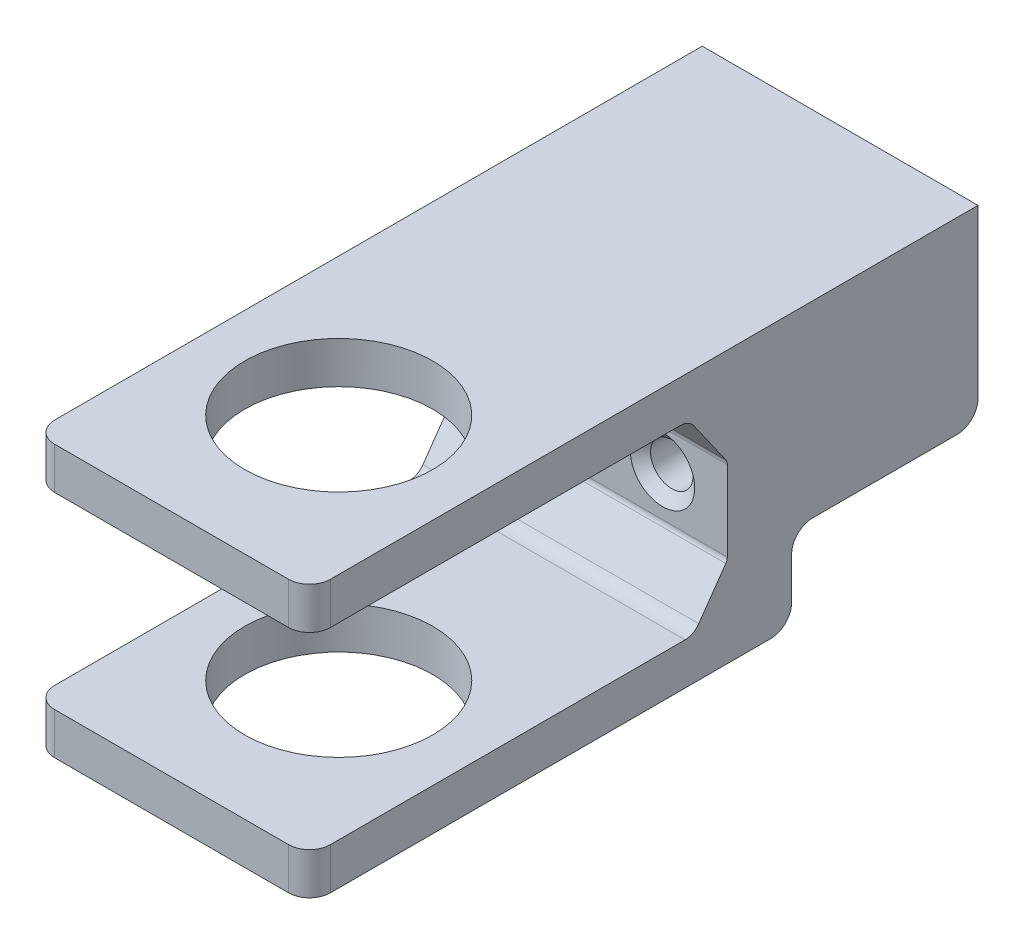
from build123d import *

# Parameters (mm, degrees)
SKETCH1_W                                          = 41.91
SKETCH1_H                                          = 101.6
BOSS_EXTRUDE1_DEPTH                                = 41.275
CUT_EXTRUDE6_DEPTH                                 = 78.72202857
SKETCH3_R                                          = 14.3002
CUT_EXTRUDE2_DEPTH                                 = 69.726833551
SKETCH17_W                                         = 28.321
SKETCH17_H                                         = 12.7
CUT_EXTRUDE7_DEPTH                                 = 78.72202857
SKETCH4_R                                          = 3.2258
CUT_EXTRUDE3_DEPTH                                 = 112.648097386
FILLET2_R                                          = 3.175
CSK_FOR_10_FLAT_HEAD_MACHINE_SCREW_100_D           = 5.6134
CSK_FOR_10_FLAT_HEAD_MACHINE_SCREW_100_DEPTH       = 38.1
CSK_FOR_10_FLAT_HEAD_MACHINE_SCREW_100_CSINK_D     = 9.779
CSK_FOR_10_FLAT_HEAD_MACHINE_SCREW_100_CSINK_ANGLE = 100
CSK_FOR_10_FLAT_HEAD_MACHINE_SCREW_100_TIP         = 1.686435499
FILLET3_R                                          = 2.54
FILLET4_R                                          = 1.27


with BuildPart() as part:
    # Sketch1 → Boss-Extrude1 (new body)
    with BuildSketch(Plane(origin=(0, 0, 0), x_dir=(1, 0, 0), z_dir=(0, 1, 0))):
        Rectangle(SKETCH1_W, SKETCH1_H)
    extrude(amount=BOSS_EXTRUDE1_DEPTH)

    # Sketch13 → Cut-Extrude6 (cut, through all)
    with BuildSketch(Plane.ZY.offset(20.955)):
        Polygon((-6.872463407, 34.925), (-12.7, 26.60241523), (-12.7, 13.632261674), (-7.600905481, 6.35), (50.8, 6.35), (50.8, 34.925), align=None)
    extrude(amount=-CUT_EXTRUDE6_DEPTH, mode=Mode.SUBTRACT)

    # Sketch3 → Cut-Extrude2 (cut, through all)
    with BuildSketch(Plane(origin=(0, 41.275, 0), x_dir=(1, 0, 0), z_dir=(0, 1, 0))):
        with Locations((0, -25.4)):
            Circle(SKETCH3_R)
    extrude(amount=-CUT_EXTRUDE2_DEPTH, mode=Mode.SUBTRACT)

    # Sketch17 → Cut-Extrude7 (cut, through all)
    with BuildSketch(Plane.ZY.offset(20.955)):
        with Locations((-36.6395, 6.35)):
            Rectangle(SKETCH17_W, SKETCH17_H)
    extrude(amount=-CUT_EXTRUDE7_DEPTH, mode=Mode.SUBTRACT)

    # Sketch4 → Cut-Extrude3 (cut, through all)
    with BuildSketch(Plane(origin=(0, 0, -50.8), x_dir=(-1, 0, 0), z_dir=(0, 0, -1))):
        with Locations((11.1125, 20.6375)):
            Circle(SKETCH4_R)
        with Locations((-11.1125, 20.6375)):
            Circle(SKETCH4_R)
    extrude(amount=-CUT_EXTRUDE3_DEPTH, mode=Mode.SUBTRACT)

    # Fillet2
    fillet2_edges = [part.edges().sort_by_distance(p)[0] for p in [
        (-20.955, 3.175, 50.8),
        (20.955, 3.175, 50.8),
        (-20.955, 38.1, 50.8),
        (20.955, 38.1, 50.8),
        (0, 12.7, -50.8),
        (0, 0, -22.479),
        (0, 12.7, -22.479),
    ]]
    fillet(fillet2_edges, radius=FILLET2_R)

    # CSK for #10 Flat Head Machine Screw (100)4
    with Locations(Plane.XY.offset(-12.7)):
        with Locations((-11.1125, 20.6375), (11.1125, 20.6375)):
            CounterSinkHole(CSK_FOR_10_FLAT_HEAD_MACHINE_SCREW_100_D / 2, CSK_FOR_10_FLAT_HEAD_MACHINE_SCREW_100_CSINK_D / 2, depth=CSK_FOR_10_FLAT_HEAD_MACHINE_SCREW_100_DEPTH, counter_sink_angle=CSK_FOR_10_FLAT_HEAD_MACHINE_SCREW_100_CSINK_ANGLE)
            with Locations((0, 0, -(CSK_FOR_10_FLAT_HEAD_MACHINE_SCREW_100_DEPTH + CSK_FOR_10_FLAT_HEAD_MACHINE_SCREW_100_TIP / 2))):  # 118° drill point
                Cone(0, CSK_FOR_10_FLAT_HEAD_MACHINE_SCREW_100_D / 2, CSK_FOR_10_FLAT_HEAD_MACHINE_SCREW_100_TIP, mode=Mode.SUBTRACT)

    # Fillet3
    fillet3_edges = [part.edges().sort_by_distance(p)[0] for p in [
        (0, 6.35, -7.600905481),
        (0, 34.925, -6.872463407),
    ]]
    fillet(fillet3_edges, radius=FILLET3_R)

    # Fillet4
    fillet4_edges = [part.edges().sort_by_distance(p)[0] for p in [
        (0, 13.632261674, -12.7),
        (0, 26.60241523, -12.7),
    ]]
    fillet(fillet4_edges, radius=FILLET4_R)


solid = part.part
